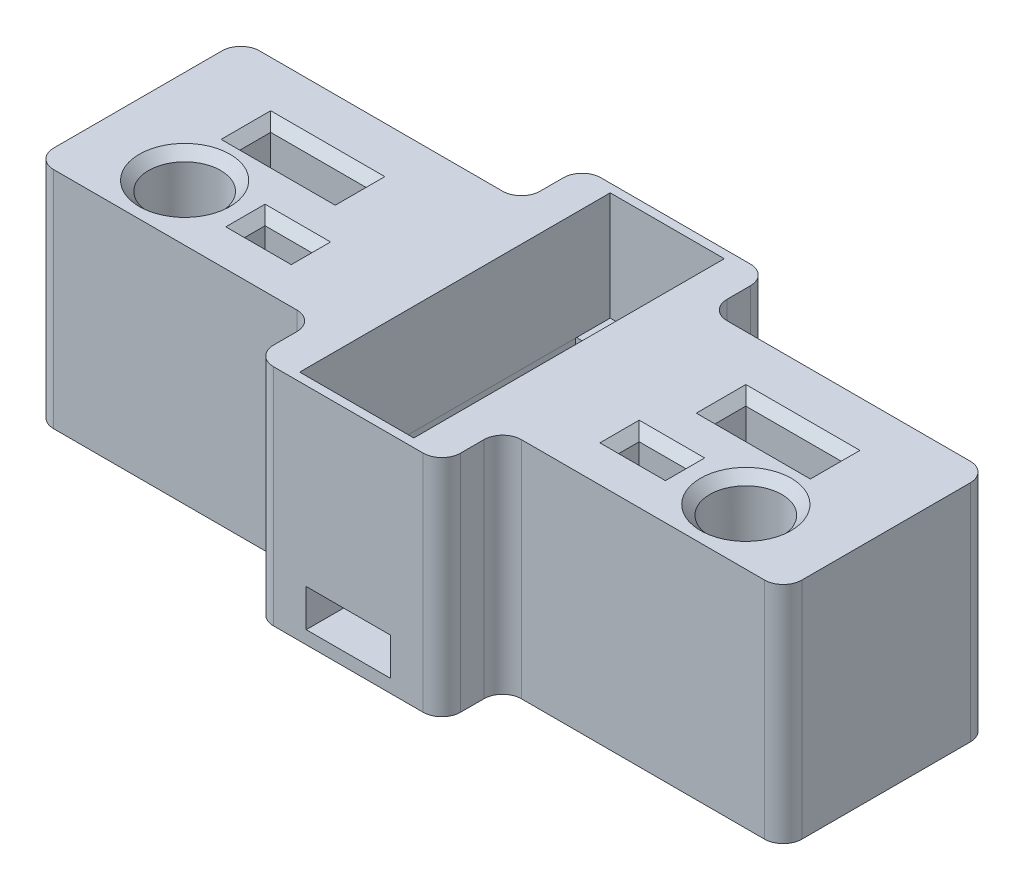
from build123d import *

# Parameters (mm, degrees)
SKETCH1_W               = 80
SKETCH1_H               = 22
BOSS_EXTRUDE1_DEPTH     = 24
SKETCH2_R               = 3.85
EYESHAFT_HOLES_DEPTH    = 15
SKETCH5_W               = 5
SKETCH5_H               = 2.2
FRONT_LEG_HOLES_DEPTH   = 13
SKETCH6_W               = 20
SKETCH6_H               = 24
SERVO_BLOCK_DEPTH       = 17.5
SKETCH7_W               = 10.2
SKETCH7_H               = 3.3
BACK_LEGS_DEPTH         = 13
FILLET1_R               = 3
SKETCH8_R               = 2.714277304
CUT_EXTRUDE4_DEPTH      = 14
SKETCH9_W               = 12.2
SKETCH9_H               = 33.2
SERVO_ARMS1_DEPTH       = 11.6
FILLET2_R               = 2
CHAMFER1_SIZE           = 1
SKETCH14_W              = 12.4
SKETCH14_H              = 25
CUT_EXTRUDE5_DEPTH      = 11
SKETCH15_W              = 9
SKETCH15_H              = 4
CUT_EXTRUDE6_DEPTH      = 5.5
SKETCH16_W              = 5
SKETCH16_H              = 1
CUT_EXTRUDE7_DEPTH      = 11
SKETCH13_R              = 0.5
SERVO_SCREW_HOLES_DEPTH = 2
FILLET3_R               = 2


with BuildPart() as part:
    # Sketch1 → Boss-Extrude1 (new body)
    with BuildSketch(Plane(origin=(0, 0, 0), x_dir=(1, 0, 0), z_dir=(0, 1, 0))):
        Rectangle(SKETCH1_W, SKETCH1_H)
    extrude(amount=BOSS_EXTRUDE1_DEPTH)

    # Sketch2 → Eyeshaft holes (cut)
    with BuildSketch(Plane(origin=(0, 24, 0), x_dir=(1, 0, 0), z_dir=(0, 1, 0))):
        with Locations(Location((-30, -5, 0), (0, 0, 270))):
            Circle(SKETCH2_R)
        with Locations(Location((30, -5, 0), (0, 0, 270))):
            Circle(SKETCH2_R)
    extrude(amount=-EYESHAFT_HOLES_DEPTH, mode=Mode.SUBTRACT)

    # Sketch5 → Front leg holes (cut)
    with BuildSketch(Plane(origin=(0, 24, 0), x_dir=(1, 0, 0), z_dir=(0, 1, 0))):
        with Locations((-20, -5)):
            Rectangle(SKETCH5_W, SKETCH5_H)
        with Locations((20, -5)):
            Rectangle(SKETCH5_W, SKETCH5_H)
    extrude(amount=-FRONT_LEG_HOLES_DEPTH, mode=Mode.SUBTRACT)

    # Sketch6 → Servo block (add, symmetric)
    with BuildSketch(Plane.XY):
        with Locations((0, 12)):
            Rectangle(SKETCH6_W, SKETCH6_H)
    extrude(amount=SERVO_BLOCK_DEPTH, both=True)

    # Sketch7 → Back Legs (cut)
    with BuildSketch(Plane(origin=(0, 24, 0), x_dir=(1, 0, 0), z_dir=(0, 1, 0))):
        with Locations((-25.75, 3.4)):
            Rectangle(SKETCH7_W, SKETCH7_H)
        with Locations((25, 3.45)):
            Rectangle(SKETCH7_W, SKETCH7_H)
    extrude(amount=-BACK_LEGS_DEPTH, mode=Mode.SUBTRACT)

    # Fillet1
    fillet1_edges = [part.edges().sort_by_distance(p)[0] for p in [
        (-30, 9, 1.15),
        (30, 9, 1.15),
    ]]
    fillet(fillet1_edges, radius=FILLET1_R)

    # Sketch8 → Cut-Extrude4 (cut)
    with BuildSketch(Plane(origin=(0, 24, 0), x_dir=(1, 0, 0), z_dir=(0, 1, 0))):
        with Locations(Location((0, -5, 0), (0, 0, 270))):
            Circle(SKETCH8_R)
    extrude(amount=-CUT_EXTRUDE4_DEPTH, mode=Mode.SUBTRACT)

    # Sketch9 → Servo arms1 (cut)
    with BuildSketch(Plane(origin=(0, 24, 0), x_dir=(1, 0, 0), z_dir=(0, 1, 0))):
        Rectangle(SKETCH9_W, SKETCH9_H)
    extrude(amount=-SERVO_ARMS1_DEPTH, mode=Mode.SUBTRACT)

    # Fillet2
    fillet2_edges = [part.edges().sort_by_distance(p)[0] for p in [
        (10, 12, -11),
        (10, 12, -17.5),
        (10, 12, 11),
        (-10, 12, -11),
        (-10, 12, -17.5),
        (-10, 12, 11),
        (10, 12, 17.5),
        (-10, 12, 17.5),
        (40, 12, 11),
        (-40, 12, 11),
        (-40, 12, -11),
        (40, 12, -11),
    ]]
    fillet(fillet2_edges, radius=FILLET2_R)

    # Chamfer1
    chamfer1_edges = [part.edges().sort_by_distance(p)[0] for p in [
        (-30, 24, 1.15),
        (30, 24, 1.15),
        (-17.5, 24, 5),
        (-20, 24, 3.9),
        (-22.5, 24, 5),
        (-20, 24, 6.1),
        (22.5, 24, 5),
        (20, 24, 3.9),
        (17.5, 24, 5),
        (20, 24, 6.1),
        (-30.85, 24, -3.4),
        (-25.75, 24, -1.75),
        (-20.65, 24, -3.4),
        (-25.75, 24, -5.05),
        (19.9, 24, -3.45),
        (25, 24, -1.8),
        (30.1, 24, -3.45),
        (25, 24, -5.1),
    ]]
    chamfer(chamfer1_edges, length=CHAMFER1_SIZE)

    # Sketch14 → Cut-Extrude5 (cut)
    with BuildSketch(Plane(origin=(0, 12.4, 0), x_dir=(1, 0, 0), z_dir=(0, 1, 0))):
        with Locations((0, 0.5)):
            Rectangle(SKETCH14_W, SKETCH14_H)
    extrude(amount=-CUT_EXTRUDE5_DEPTH, mode=Mode.SUBTRACT)

    # Sketch15 → Cut-Extrude6 (cut)
    with BuildSketch(Plane.XY.offset(17.5)):
        with Locations((0, 3.4)):
            Rectangle(SKETCH15_W, SKETCH15_H)
    extrude(amount=-CUT_EXTRUDE6_DEPTH, mode=Mode.SUBTRACT)

    # Sketch16 → Cut-Extrude7 (cut)
    with BuildSketch(Plane(origin=(0, 12.4, 0), x_dir=(1, 0, 0), z_dir=(0, 1, 0))):
        with Locations((0, -12)):
            Rectangle(SKETCH16_W, SKETCH16_H)
    extrude(amount=-CUT_EXTRUDE7_DEPTH, mode=Mode.SUBTRACT)

    # Sketch13 → Servo Screw Holes (cut)
    with BuildSketch(Plane(origin=(0, 12.4, 0), x_dir=(1, 0, 0), z_dir=(0, 1, 0))):
        with Locations(Location((0.1, 15, 0), (0, 0, 270))):
            Circle(SKETCH13_R)
        with Locations(Location((0.1, -14.5, 0), (0, 0, 270))):
            Circle(SKETCH13_R)
    extrude(amount=-SERVO_SCREW_HOLES_DEPTH, mode=Mode.SUBTRACT)

    # Fillet3
    fillet3_edges = [part.edges().sort_by_distance(p)[0] for p in [
        (0, 5.4, 12.5),
        (2.5, 5.4, 12.25),
        (-2.5, 5.4, 12.25),
    ]]
    fillet(fillet3_edges, radius=FILLET3_R - 0.0001)  # a hair under: the kernel refuses the full size


solid = part.part
